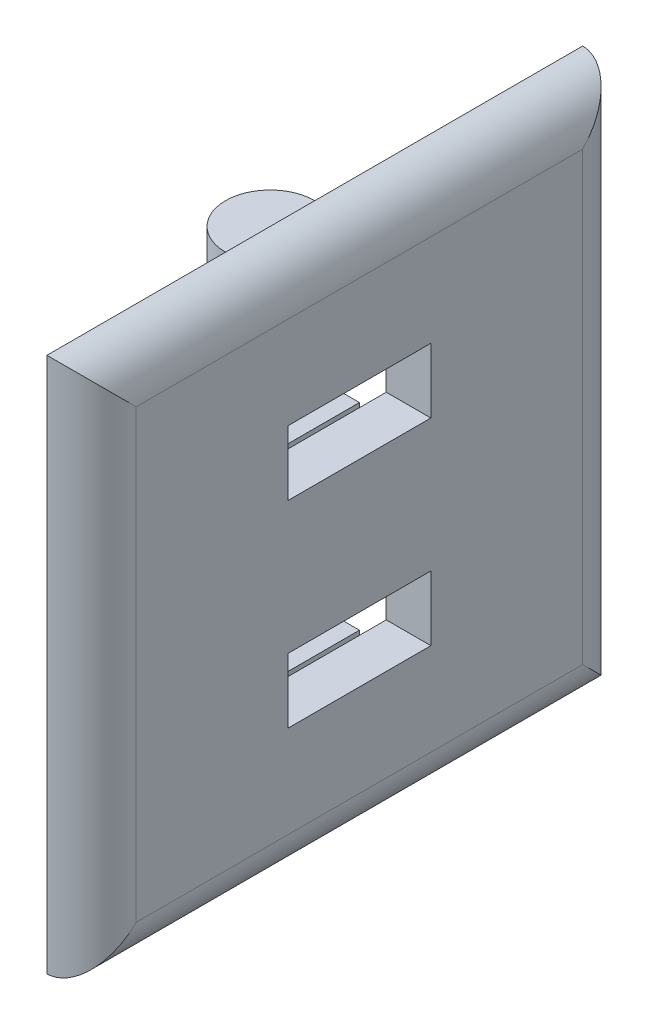
from build123d import *

# Parameters (mm, degrees)
SKETCH2_W           = 120
SKETCH2_H           = 120
BOSS_EXTRUDE1_DEPTH = 5
FILLET1_R           = 10
BOSS_EXTRUDE2_DEPTH = 50
SKETCH3_W           = 12.5
SKETCH3_H           = 30
CUT_EXTRUDE1_DEPTH  = 91
SKETCH5_W           = 14.5
SKETCH5_H           = 32
CUT_EXTRUDE2_DEPTH  = 10


with BuildPart() as part:
    # Sketch2 → Boss-Extrude1 (new, symmetric)
    with BuildSketch(Plane.YZ):
        Rectangle(SKETCH2_W, SKETCH2_H)
    extrude(amount=BOSS_EXTRUDE1_DEPTH, both=True)

    # Fillet1
    fillet1_edges = [part.edges().sort_by_distance(p)[0] for p in [
        (5, 60, 0),
        (5, 0, -60),
        (5, -60, 0),
        (5, 0, 60),
    ]]
    fillet(fillet1_edges, radius=FILLET1_R - 0.0001)  # a hair under: the kernel refuses the full size

    # Sketch4 → Boss-Extrude2 (add, symmetric)
    with BuildSketch(Plane(origin=(0, 0, 0), x_dir=(-1, 0, 0), z_dir=(0, 1, 0))):
        with BuildLine():
            Line((15, 10), (5, 10))
            Line((5, 10), (5, -10))
            Line((5, -10), (15, -10))
            ThreePointArc((15, -10), (25, 0), (15, 10))
        make_face()
    extrude(amount=BOSS_EXTRUDE2_DEPTH, both=True)

    # Sketch3 → Cut-Extrude1 (cut, through all)
    with BuildSketch(Plane.YZ.offset(5)):
        with Locations((-22.083333333, 0)):
            Rectangle(SKETCH3_W, SKETCH3_H)
        with Locations((22.083333333, 0)):
            Rectangle(SKETCH3_W, SKETCH3_H)
    extrude(amount=-CUT_EXTRUDE1_DEPTH, mode=Mode.SUBTRACT)

    # Sketch5 → Cut-Extrude2 (cut)
    with BuildSketch(Plane.YZ.offset(5)):
        with Locations((22.083333333, 0)):
            Rectangle(SKETCH5_W, SKETCH5_H)
        with Locations((-22.083333333, 0)):
            Rectangle(SKETCH5_W, SKETCH5_H)
    extrude(amount=-CUT_EXTRUDE2_DEPTH, mode=Mode.SUBTRACT)


solid = part.part
